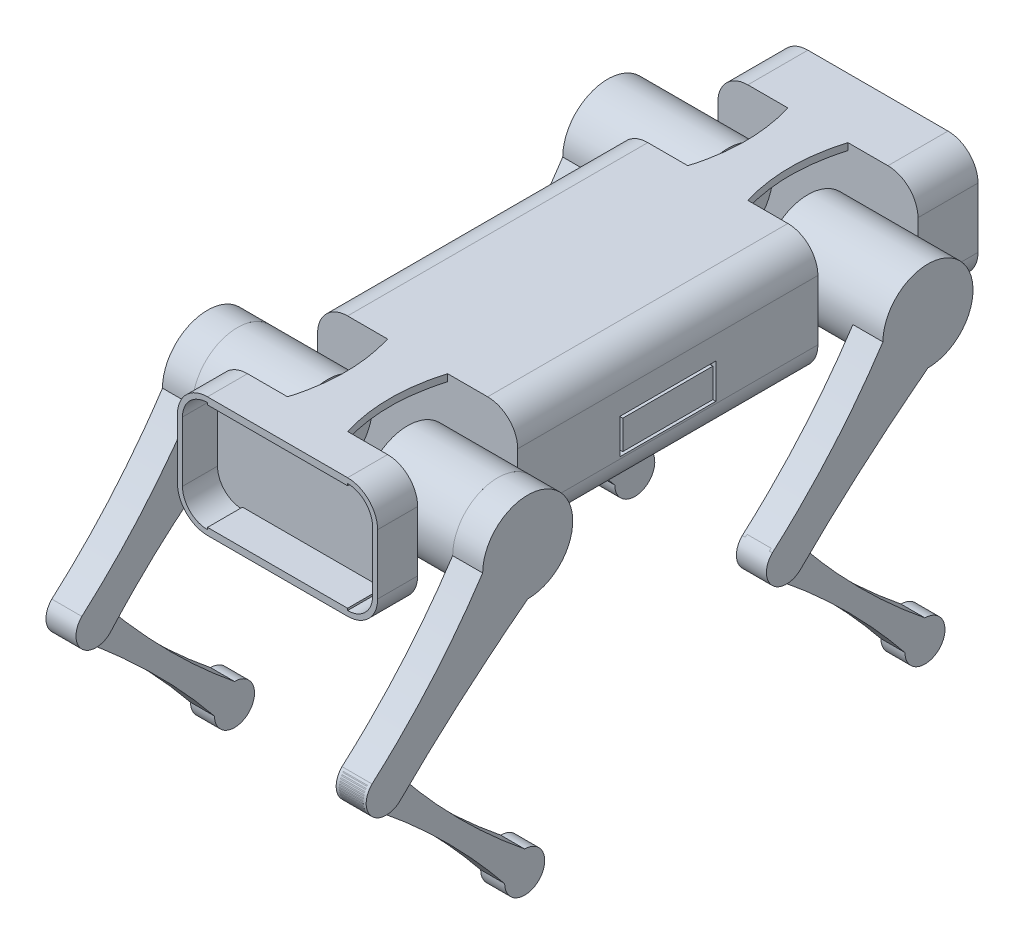
from build123d import *

# Parameters (mm, degrees)
EXTRUDE_361_DEPTH    = 300
SKETCH_3_R           = 45
EXTRUDE_564_DEPTH    = 130
EXTRUDE_564_2_DEPTH  = 130
SKETCH_6_R           = 45
CUT_EXTRUDE_1_DEPTH  = 40
EXTRUDE_958_DEPTH    = 30
EXTRUDE_1292_DEPTH   = 30
EXTRUDE_1714_DEPTH   = 7
EXTRUDE_1714_2_DEPTH = 7
EXTRUDE_2158_DEPTH   = 7
EXTRUDE_START        = -5
EXTRUDE_2428_DEPTH   = 5
EXTRUDE_START_2      = -60
EXTRUDE_2510_DEPTH   = 60
EXTRUDE_2820_DEPTH   = 5
EXTRUDE_2913_DEPTH   = 40
EXTRUDE_START_3      = 3
EXTRUDE_3166_DEPTH   = 24
SKETCH_15_W          = 40
SKETCH_15_H          = 110
SKETCH_15_W_2        = 30
SKETCH_15_H_2        = 100
EXTRUDE_3356_DEPTH   = 5
EXTRUDE_3602_DEPTH   = 24
SKETCH_17_W          = 96
SKETCH_17_H          = 36
SKETCH_17_W_2        = 90
SKETCH_17_H_2        = 30
CUT_EXTRUDE_2_DEPTH  = 5
SKETCH_18_W          = 96
SKETCH_18_H          = 34.96038607
SKETCH_18_W_2        = 90
SKETCH_18_H_2        = 28.96038607
CUT_EXTRUDE_4_DEPTH  = 5


with BuildPart() as part:
    # 草图1 → Extrude 361 (new body)
    with BuildSketch(Plane.XY):
        with BuildLine():
            Line((-100, 30), (-100, -30))
            ThreePointArc((-100, -30), (-91.213203436, -51.213203436), (-70, -60))
            Line((-70, -60), (70, -60))
            ThreePointArc((70, -60), (91.213203436, -51.213203436), (100, -30))
            Line((100, -30), (100, 30))
            ThreePointArc((100, 30), (91.213203436, 51.213203436), (70, 60))
            Line((70, 60), (-70, 60))
            ThreePointArc((-70, 60), (-91.213203436, 51.213203436), (-100, 30))
        make_face()
    extrude(amount=EXTRUDE_361_DEPTH)

    # 草图11 → Extrude 2158 (add)
    with BuildSketch(Plane(origin=(0, -60, 0), x_dir=(-1, 0, 0), z_dir=(0, -1, 0))):
        with BuildLine():
            Line((-30, 100), (-70, 100))
            Line((-70, 100), (-70, 160))
            Line((-70, 160), (70, 160))
            Line((70, 160), (70, 100))
            Line((70, 100), (30, 100))
            add(Edge.make_bspline(
                [(30, 100), (11.25, 49.999999999), (30, 0)],
                knots=[0, 0, 0, 1, 1, 1], degree=2))
            Line((30, 0), (-30, 0))
            add(Edge.make_bspline(
                [(-30, 100), (-11.25, 50.000000001), (-30, 0)],
                knots=[0, 0, 0, 1, 1, 1], degree=2))
        make_face()
        with BuildLine():
            Line((-70, -440), (70, -440))
            Line((70, -440), (70, -400))
            Line((70, -400), (30, -400))
            add(Edge.make_bspline(
                [(30, -300), (11.25, -350.000000001), (30, -400)],
                knots=[0, 0, 0, 1, 1, 1], degree=2))
            Line((30, -300), (-30, -300))
            add(Edge.make_bspline(
                [(-30, -300), (-11.25, -349.999999999), (-30, -400)],
                knots=[0, 0, 0, 1, 1, 1], degree=2))
            Line((-30, -400), (-70, -400))
            Line((-70, -400), (-70, -440))
        make_face()
    extrude(amount=-EXTRUDE_2158_DEPTH)



with BuildPart() as body_2:
    # 草图3 → Extrude 564 (new, symmetric)
    with BuildSketch(Plane.ZY):
        with Locations((-50, 0)):
            Circle(SKETCH_3_R)
    extrude(amount=EXTRUDE_564_DEPTH, both=True)


with BuildPart() as body_3:
    # 草图3 → Extrude 564 2 (new, symmetric)
    with BuildSketch(Plane.ZY):
        with Locations((350, 0)):
            Circle(SKETCH_3_R)
    extrude(amount=EXTRUDE_564_2_DEPTH, both=True)


with BuildPart() as cut_extrude_1_tool:
    # 草图6 → 髋部切1 (new, symmetric)
    with BuildSketch(Plane.ZY):
        with Locations((-50, 0)):
            Circle(SKETCH_6_R)
        with Locations((350, 0)):
            Circle(SKETCH_6_R)
    extrude(amount=CUT_EXTRUDE_1_DEPTH, both=True)


with BuildPart() as body_2_1:
    add(body_2.part)

    # 髋部切1: cut by cut_extrude_1_tool
    add(cut_extrude_1_tool.part, mode=Mode.SUBTRACT)


with BuildPart() as body_3_1:
    add(body_3.part)

    # 髋部切1: cut by cut_extrude_1_tool
    add(cut_extrude_1_tool.part, mode=Mode.SUBTRACT)


with BuildPart() as cut_extrude_1_piece_1:
    # of the separate pieces the step leaves, piece 1, a body of its own (cut_extrude_1_pieces)
    add(body_2_1.part.solids().sort_by_distance((130, 0, -5))[0])

    # 草图8 → Extrude 1292 (add)
    with BuildSketch(Plane(origin=(130, 0, 0), x_dir=(0, 0, -1), z_dir=(1, 0, 0))):
        with BuildLine():
            ThreePointArc((-395, 0), (-318.180194847, 31.819805153), (-350, -45))
            add(Edge.make_bspline(
                [(-350, -45), (-420.82073531, -99.10500656), (-477.279220616, -155.563491864)],
                knots=[0, 0, 0, 1, 1, 1], degree=2))
            ThreePointArc((-477.279220616, -155.563491864), (-505.563491864, -155.563491864), (-505.563491864, -127.279220616))
            add(Edge.make_bspline(
                [(-395, 0), (-441.831252838, -71.034695113), (-505.563491864, -127.279220616)],
                knots=[0, 0, 0, 1, 1, 1], degree=2))
        make_face()
        with BuildLine():
            ThreePointArc((5, 0), (81.819805153, 31.819805153), (50, -45))
            add(Edge.make_bspline(
                [(50, -45), (-20.820735309, -99.105006556), (-77.279220614, -155.563491861)],
                knots=[0, 0, 0, 1, 1, 1], degree=2))
            ThreePointArc((-77.279220614, -155.563491861), (-105.563491861, -155.563491861), (-105.563491861, -127.279220614))
            add(Edge.make_bspline(
                [(5, 0), (-41.83125284, -71.034695108), (-105.563491861, -127.279220614)],
                knots=[0, 0, 0, 1, 1, 1], degree=2))
        make_face()
    extrude(amount=EXTRUDE_1292_DEPTH)


with BuildPart() as cut_extrude_1_piece_2:
    # of the separate pieces the step leaves, piece 2, a body of its own (cut_extrude_1_pieces)
    add(body_2_1.part.solids().sort_by_distance((-40, 0, -5))[0])

    # 草图7 → Extrude 958 (add)
    with BuildSketch(Plane.ZY.offset(130)):
        with BuildLine():
            ThreePointArc((77.279220614, -155.563491861), (105.563491861, -155.563491861), (105.563491861, -127.279220614))
            add(Edge.make_bspline(
                [(-5, 0), (41.831252845, -71.034695104), (105.563491861, -127.279220614)],
                knots=[0, 0, 0, 1, 1, 1], degree=2))
            ThreePointArc((-5, 0), (-81.819805153, 31.819805153), (-50, -45))
            add(Edge.make_bspline(
                [(-50, -45), (21.034695104, -91.831252845), (77.279220614, -155.563491861)],
                knots=[0, 0, 0, 1, 1, 1], degree=2))
        make_face()
        with BuildLine():
            ThreePointArc((477.279220616, -155.563491864), (505.563491864, -155.563491864), (505.563491864, -127.279220616))
            add(Edge.make_bspline(
                [(395, 0), (441.831252849, -71.034695103), (505.563491864, -127.279220616)],
                knots=[0, 0, 0, 1, 1, 1], degree=2))
            ThreePointArc((395, 0), (318.180194847, 31.819805153), (350, -45))
            add(Edge.make_bspline(
                [(350, -45), (421.034695103, -91.831252849), (477.279220616, -155.563491864)],
                knots=[0, 0, 0, 1, 1, 1], degree=2))
        make_face()
    extrude(amount=EXTRUDE_958_DEPTH)


with BuildPart() as cut_extrude_1_piece_1_of_body_3:
    # of the separate pieces the step leaves, piece 1, a body of its own (cut_extrude_1_pieces_of_body_3)
    add(body_3_1.part.solids().sort_by_distance((130, 0, 395))[0])


with BuildPart() as cut_extrude_1_piece_2_of_body_3:
    # of the separate pieces the step leaves, piece 2, a body of its own (cut_extrude_1_pieces_of_body_3)
    add(body_3_1.part.solids().sort_by_distance((-40, 0, 395))[0])


with BuildPart() as extrude_958_piece_1:
    # of the separate pieces the step leaves, piece 1, a body of its own (extrude_958_pieces)
    add(cut_extrude_1_piece_2.part.solids().sort_by_distance((-130, -45, -50))[0])

    # 草图14 → Extrude 3166 (add)
    with BuildSketch(Plane.ZY.offset(130).offset(EXTRUDE_START_3)):
        with BuildLine():
            ThreePointArc((80.81475452, -130.81475452), (102.027957955, -130.81475452), (102.027957955, -152.027957955))
            add(Edge.make_bspline(
                [(-30, -282.842712475), (24.246212025, -215.667568262), (102.027957955, -152.027957955)],
                knots=[0, 0, 0, 1, 1, 1], degree=2))
            ThreePointArc((-30, -282.842712475), (-64.142135624, -296.984848098), (-50, -262.842712475))
            add(Edge.make_bspline(
                [(80.81475452, -130.81475452), (17.175144213, -208.59650045), (-50, -262.842712475)],
                knots=[0, 0, 0, 1, 1, 1], degree=2))
        make_face()
        with BuildLine():
            ThreePointArc((480.814754522, -130.814754522), (502.027957958, -130.814754522), (502.027957958, -152.027957958))
            add(Edge.make_bspline(
                [(370, -282.84271247), (424.24621202, -215.66756826), (502.027957958, -152.027957958)],
                knots=[0, 0, 0, 1, 1, 1], degree=2))
            ThreePointArc((370, -282.84271247), (335.857864376, -296.984848094), (350, -262.84271247))
            add(Edge.make_bspline(
                [(480.814754522, -130.814754522), (417.17514421, -208.59650045), (350, -262.84271247)],
                knots=[0, 0, 0, 1, 1, 1], degree=2))
        make_face()
    extrude(amount=EXTRUDE_3166_DEPTH)


with BuildPart() as extrude_958_piece_2:
    # of the separate pieces the step leaves, piece 2, a body of its own (extrude_958_pieces)
    add(cut_extrude_1_piece_2.part.solids().sort_by_distance((-130, -45, 350))[0])


with BuildPart() as extrude_1292_piece_1:
    # of the separate pieces the step leaves, piece 1, a body of its own (extrude_1292_pieces)
    add(cut_extrude_1_piece_1.part.solids().sort_by_distance((130, -45, -50))[0])

    # 草图16 → Extrude 3602 (add)
    with BuildSketch(Plane(origin=(130, 0, 0), x_dir=(0, 0, -1), z_dir=(1, 0, 0)).offset(EXTRUDE_START_3)):
        with BuildLine():
            ThreePointArc((-91.421356237, -161.421356237), (-105.563491861, -127.279220614), (-71.421356237, -141.421356237))
            add(Edge.make_bspline(
                [(-71.421356237, -141.421356237), (-17.175144213, -208.59650045), (50, -262.842712475)],
                knots=[0, 0, 0, 1, 1, 1], degree=2))
            ThreePointArc((50, -262.842712475), (64.142135624, -296.984848098), (30, -282.842712475))
            add(Edge.make_bspline(
                [(-91.421356237, -161.421356237), (-24.246212025, -215.667568262), (30, -282.842712475)],
                knots=[0, 0, 0, 1, 1, 1], degree=2))
        make_face()
        with BuildLine():
            ThreePointArc((-491.42135624, -161.42135624), (-505.563491864, -127.279220616), (-471.42135624, -141.42135624))
            add(Edge.make_bspline(
                [(-471.42135624, -141.42135624), (-417.17514421, -208.59650045), (-350, -262.84271247)],
                knots=[0, 0, 0, 1, 1, 1], degree=2))
            ThreePointArc((-350, -262.84271247), (-335.857864376, -296.984848094), (-370, -282.84271247))
            add(Edge.make_bspline(
                [(-491.42135624, -161.42135624), (-424.24621202, -215.66756826), (-370, -282.84271247)],
                knots=[0, 0, 0, 1, 1, 1], degree=2))
        make_face()
    extrude(amount=EXTRUDE_3602_DEPTH)


with BuildPart() as extrude_1292_piece_2:
    # of the separate pieces the step leaves, piece 2, a body of its own (extrude_1292_pieces)
    add(cut_extrude_1_piece_1.part.solids().sort_by_distance((130, -45, 350))[0])


with BuildPart() as body_8:
    # 草图10 → Extrude 1714 (new body)
    with BuildSketch(Plane(origin=(0, 60, 0), x_dir=(1, 0, 0), z_dir=(0, 1, 0))):
        with BuildLine():
            Line((70, 100), (30, 100))
            add(Edge.make_bspline(
                [(30, 100), (15, 50), (30, 0)],
                knots=[0, 0, 0, 1, 1, 1], degree=2))
            Line((30, 0), (-30, 0))
            add(Edge.make_bspline(
                [(-30, 100), (-15, 50), (-30, 0)],
                knots=[0, 0, 0, 1, 1, 1], degree=2))
            Line((-30, 100), (-70, 100))
            Line((-70, 100), (-70, 160))
            Line((-70, 160), (70, 160))
            Line((70, 160), (70, 100))
        make_face()
    extrude(amount=-EXTRUDE_1714_DEPTH)


with BuildPart() as body_9:
    # 草图10 → Extrude 1714 2 (new body)
    with BuildSketch(Plane(origin=(0, 60, 0), x_dir=(1, 0, 0), z_dir=(0, 1, 0))):
        with BuildLine():
            Line((70, -400), (70, -440))
            Line((70, -440), (-70, -440))
            Line((-70, -440), (-70, -400))
            Line((-70, -400), (-30, -400))
            add(Edge.make_bspline(
                [(-30, -400), (-15, -350), (-30, -300)],
                knots=[0, 0, 0, 1, 1, 1], degree=2))
            Line((-30, -300), (30, -300))
            add(Edge.make_bspline(
                [(30, -400), (15, -350), (30, -300)],
                knots=[0, 0, 0, 1, 1, 1], degree=2))
            Line((30, -400), (70, -400))
        make_face()
    extrude(amount=-EXTRUDE_1714_2_DEPTH)


with BuildPart() as part_1:
    add(part.part)

    add(body_8.part)  # Extrude 2428 merges body 8
    # 草图12 → Extrude 2428 (add)
    with BuildSketch(Plane.XY.offset(-100).offset(EXTRUDE_START)):
        with BuildLine():
            Line((-70, -60), (70, -60))
            ThreePointArc((70, -60), (91.213203436, -51.213203436), (100, -30))
            Line((100, -30), (100, 30))
            ThreePointArc((100, 30), (91.213203436, 51.213203436), (70, 60))
            Line((70, 60), (-70, 60))
            ThreePointArc((-70, 60), (-91.213203436, 51.213203436), (-100, 30))
            Line((-100, 30), (-100, -30))
            ThreePointArc((-100, -30), (-91.213203436, -51.213203436), (-70, -60))
        make_face()
    extrude(amount=EXTRUDE_2428_DEPTH)

    # 草图12<2> → Extrude 2510 (add)
    with BuildSketch(Plane.XY.offset(-100).offset(EXTRUDE_START_2)):
        with BuildLine():
            Line((-70, -60), (70, -60))
            ThreePointArc((70, -60), (91.213203436, -51.213203436), (100, -30))
            Line((100, -30), (100, 30))
            ThreePointArc((100, 30), (91.213203436, 51.213203436), (70, 60))
            Line((70, 60), (-70, 60))
            ThreePointArc((-70, 60), (-91.213203436, 51.213203436), (-100, 30))
            Line((-100, 30), (-100, -30))
            ThreePointArc((-100, -30), (-91.213203436, -51.213203436), (-70, -60))
        make_face()
        with BuildLine():
            Line((-70, -55), (70, -55))
            ThreePointArc((70, -55), (87.67766953, -47.67766953), (95, -30))
            Line((95, -30), (95, 30))
            ThreePointArc((95, 30), (87.67766953, 47.67766953), (70, 55))
            Line((70, 55), (-70, 55))
            ThreePointArc((-70, 55), (-87.67766953, 47.67766953), (-95, 30))
            Line((-95, 30), (-95, -30))
            ThreePointArc((-95, -30), (-87.67766953, -47.67766953), (-70, -55))
        make_face(mode=Mode.SUBTRACT)
    extrude(amount=EXTRUDE_2510_DEPTH)


    add(body_9.part)  # Extrude 2820 merges body 9
    # 草图13 → Extrude 2820 (add)
    with BuildSketch(Plane(origin=(0, 0, 400), x_dir=(-1, 0, 0), z_dir=(0, 0, -1))):
        with BuildLine():
            Line((70, -60), (-70, -60))
            ThreePointArc((-70, -60), (-91.213203436, -51.213203436), (-100, -30))
            Line((-100, -30), (-100, 30))
            ThreePointArc((-100, 30), (-91.213203436, 51.213203436), (-70, 60))
            Line((-70, 60), (70, 60))
            ThreePointArc((70, 60), (91.213203436, 51.213203436), (100, 30))
            Line((100, 30), (100, -30))
            ThreePointArc((100, -30), (91.213203436, -51.213203436), (70, -60))
        make_face()
    extrude(amount=-EXTRUDE_2820_DEPTH)

    # 草图13<2> → Extrude 2913 (add)
    with BuildSketch(Plane(origin=(0, 0, 400), x_dir=(-1, 0, 0), z_dir=(0, 0, -1))):
        with BuildLine():
            Line((-100, -30), (-100, 30))
            ThreePointArc((-100, 30), (-91.213203436, 51.213203436), (-70, 60))
            Line((-70, 60), (70, 60))
            ThreePointArc((70, 60), (91.213203436, 51.213203436), (100, 30))
            Line((100, 30), (100, -30))
            ThreePointArc((100, -30), (91.213203436, -51.213203436), (70, -60))
            Line((70, -60), (-70, -60))
            ThreePointArc((-70, -60), (-91.213203436, -51.213203436), (-100, -30))
        make_face()
        with BuildLine():
            Line((-95, -30), (-95, 30))
            ThreePointArc((-95, 30), (-87.67766953, 47.67766953), (-70, 55))
            Line((-70, 55), (70, 55))
            ThreePointArc((70, 55), (87.67766953, 47.67766953), (95, 30))
            Line((95, 30), (95, -30))
            ThreePointArc((95, -30), (87.67766953, -47.67766953), (70, -55))
            Line((70, -55), (-70, -55))
            ThreePointArc((-70, -55), (-87.67766953, -47.67766953), (-95, -30))
        make_face(mode=Mode.SUBTRACT)
    extrude(amount=-EXTRUDE_2913_DEPTH)

    # 草图15 → Extrude 3356 (add)
    # profile 1 of 2: a face of its own
    with BuildSketch(Plane(origin=(0, -60, 0), x_dir=(-1, 0, 0), z_dir=(0, -1, 0))):
        Polygon((-20, -5), (-20, 105), (19.96759198, 105), (20.682894105, -5), align=None)
        Polygon((-15, 0), (-15, 100), (15, 100), (15.650274659, 0), align=None, mode=Mode.SUBTRACT)
    # profile 2 of 2: a face of its own
    with BuildSketch(Plane(origin=(0, -60, 0), x_dir=(-1, 0, 0), z_dir=(0, -1, 0))):
        with Locations((0, -350)):
            Rectangle(SKETCH_15_W, SKETCH_15_H)
        with Locations((0, -350)):
            Rectangle(SKETCH_15_W_2, SKETCH_15_H_2, mode=Mode.SUBTRACT)
    extrude(amount=EXTRUDE_3356_DEPTH)

    # 草图17 → 切除-拉伸-薄壁2 (cut)
    with BuildSketch(Plane.ZY.offset(100)):
        with Locations((150, -11)):
            Rectangle(SKETCH_17_W, SKETCH_17_H)
        with Locations((150, -11)):
            Rectangle(SKETCH_17_W_2, SKETCH_17_H_2, mode=Mode.SUBTRACT)
    extrude(amount=-CUT_EXTRUDE_2_DEPTH, mode=Mode.SUBTRACT)

    # 草图18 → 切除-拉伸-薄壁4 (cut)
    with BuildSketch(Plane(origin=(100, 0, 0), x_dir=(0, 0, -1), z_dir=(1, 0, 0))):
        with Locations((-150, -10.480193035)):
            Rectangle(SKETCH_18_W, SKETCH_18_H)
        with Locations((-150, -10.480193035)):
            Rectangle(SKETCH_18_W_2, SKETCH_18_H_2, mode=Mode.SUBTRACT)
    extrude(amount=-CUT_EXTRUDE_4_DEPTH, mode=Mode.SUBTRACT)


with BuildPart() as extrude_3166_piece_1:
    # of the separate pieces the step leaves, piece 1, a body of its own (extrude_3166_pieces)
    add(extrude_958_piece_1.part.solids().sort_by_distance((-130, -45, -50))[0])


with BuildPart() as extrude_3166_piece_2:
    # of the separate pieces the step leaves, piece 2, a body of its own (extrude_3166_pieces)
    add(extrude_958_piece_1.part.solids().sort_by_distance((-133, -282.84271247, 370))[0])


with BuildPart() as extrude_3602_piece_1:
    # of the separate pieces the step leaves, piece 1, a body of its own (extrude_3602_pieces)
    add(extrude_1292_piece_1.part.solids().sort_by_distance((130, -45, -50))[0])


with BuildPart() as extrude_3602_piece_2:
    # of the separate pieces the step leaves, piece 2, a body of its own (extrude_3602_pieces)
    add(extrude_1292_piece_1.part.solids().sort_by_distance((133, -262.84271247, 350))[0])


solid = Compound([cut_extrude_1_piece_1_of_body_3.part, cut_extrude_1_piece_2_of_body_3.part, extrude_958_piece_2.part, extrude_1292_piece_2.part, part_1.part, extrude_3166_piece_1.part, extrude_3166_piece_2.part, extrude_3602_piece_1.part, extrude_3602_piece_2.part])
